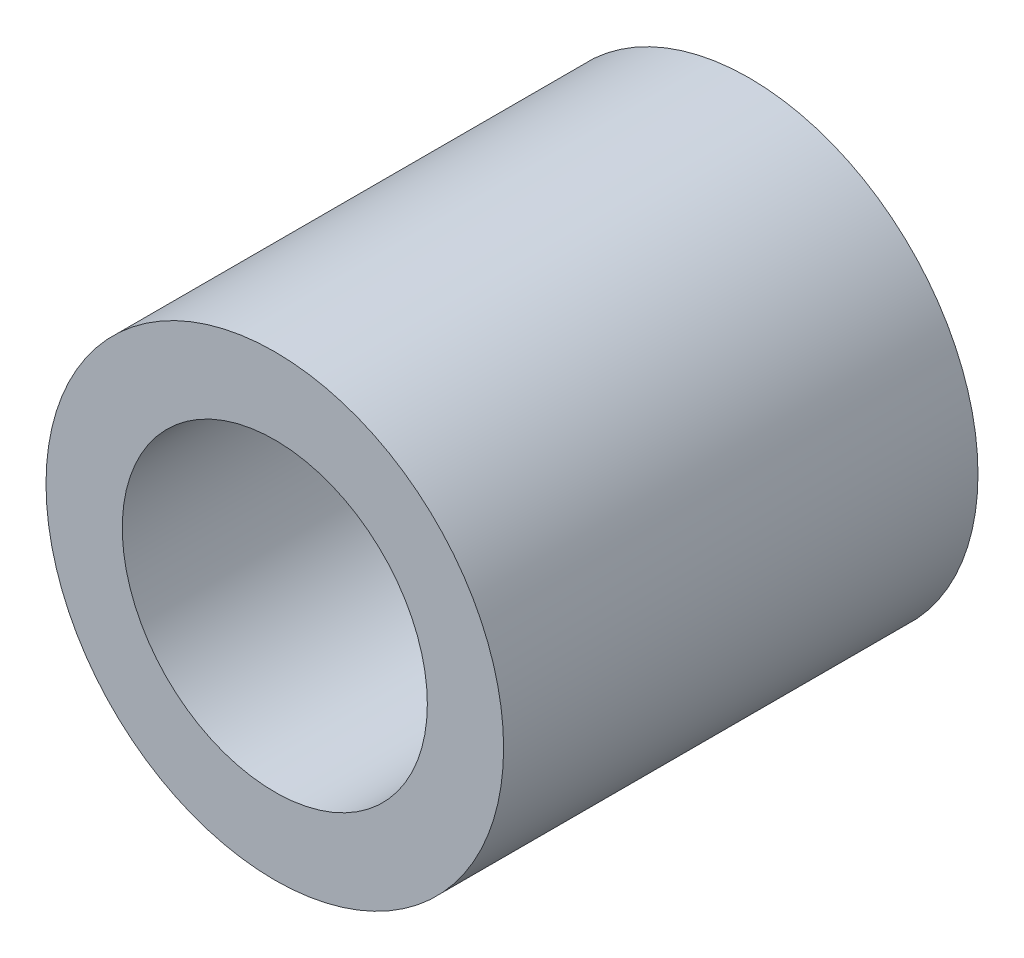
from build123d import *

# Parameters (mm, degrees)
SKETCH1_R           = 9.525
SKETCH1_R_2         = 6.35
BOSS_EXTRUDE1_DEPTH = 9.87425


with BuildPart() as part:
    # Sketch1 → Boss-Extrude1 (new, symmetric)
    with BuildSketch(Plane.XY):
        Circle(SKETCH1_R)
        Circle(SKETCH1_R_2, mode=Mode.SUBTRACT)
    extrude(amount=BOSS_EXTRUDE1_DEPTH, both=True)


solid = part.part
